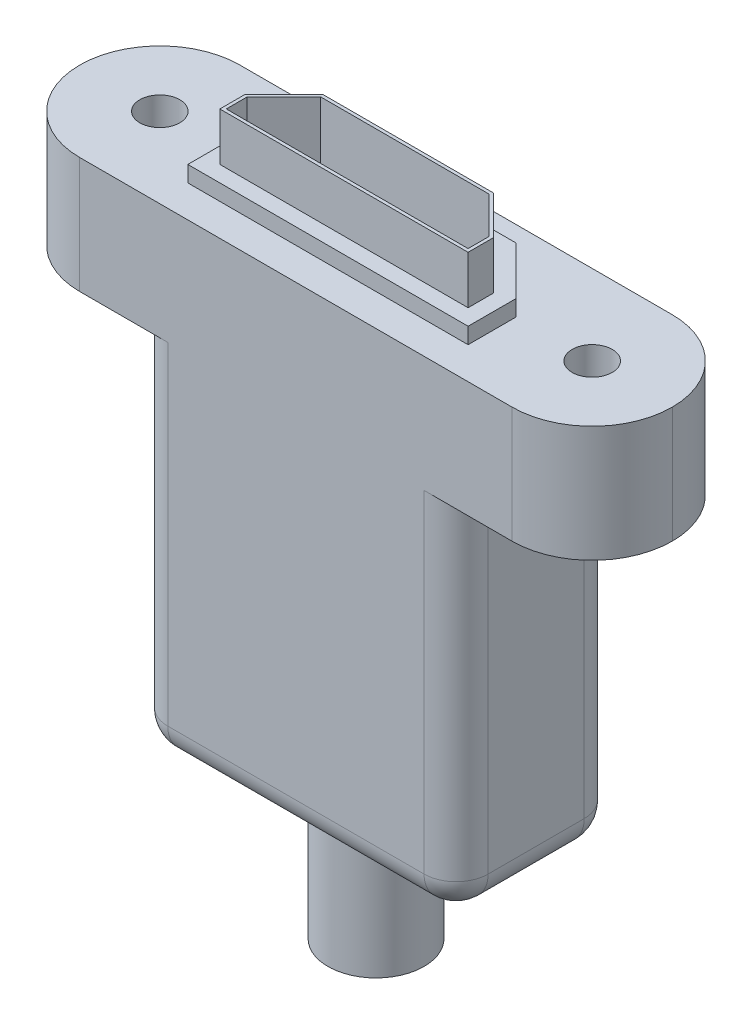
from build123d import *

# Parameters (mm, degrees)
SKETCH_1_W          = 37
SKETCH_1_H          = 10
EXTRUDE_1_DEPTH     = 7.25
EXTRUDE_2_DEPTH     = 4
FILLET_1_R          = 5
CUT_EXTRUDE_1_DEPTH = 3
CUT_EXTRUDE_3_DEPTH = 4
HOLE_WIZARD_M3_1_D  = 2.5
SKETCH_7_W          = 20.003423604
SKETCH_7_H          = 10
EXTRUDE_3_DEPTH     = 22.75
SKETCH_8_R          = 3
EXTRUDE_4_DEPTH     = 8
FILLET_2_R          = 2


with BuildPart() as part:
    # 草图1 → 凸台-拉伸1 (new body)
    with BuildSketch(Plane(origin=(0, 0, 0), x_dir=(1, 0, 0), z_dir=(0, 1, 0))):
        Rectangle(SKETCH_1_W, SKETCH_1_H)
    extrude(amount=EXTRUDE_1_DEPTH)

    # 草图2 → 凸台-拉伸2 (add)
    with BuildSketch(Plane(origin=(0, 7.25, 0), x_dir=(1, 0, 0), z_dir=(0, 1, 0))):
        Polygon((-8.75, 0), (-5.75, 3), (5.75, 3), (8.75, 0), (8.75, -3), (-8.75, -3), align=None)
    extrude(amount=EXTRUDE_2_DEPTH)

    # 圆角1
    fillet_1_edges = [part.edges().sort_by_distance(p)[0] for p in [
        (18.5, 3.625, 5),
        (18.5, 3.625, -5),
        (-18.5, 3.625, 5),
        (-18.5, 3.625, -5),
    ]]
    fillet(fillet_1_edges, radius=FILLET_1_R - 0.0001)  # a hair under: the kernel refuses the full size

    # 草图3 → 切除-拉伸1 (cut)
    with BuildSketch(Plane(origin=(0, 11.25, 0), x_dir=(1, 0, 0), z_dir=(0, 1, 0))):
        Polygon((8.75, -3), (8.75, 0), (5.75, 3), (-5.75, 3), (-8.75, 0), (-8.75, -3), align=None)
        Polygon((7.75, -2), (7.75, -0.414213562), (5.335786438, 2), (-5.335786438, 2), (-7.75, -0.414213562), (-7.75, -2), align=None, mode=Mode.SUBTRACT)
    extrude(amount=-CUT_EXTRUDE_1_DEPTH, mode=Mode.SUBTRACT)

    # 草图4 → 切除-拉伸3 (cut)
    with BuildSketch(Plane(origin=(0, 11.25, 0), x_dir=(1, 0, 0), z_dir=(0, 1, 0))):
        Polygon((-7.55, -0.497056275), (-7.55, -1.8), (7.55, -1.8), (7.55, -0.497056275), (5.252943725, 1.8), (-5.252943725, 1.8), align=None)
    extrude(amount=-CUT_EXTRUDE_3_DEPTH, mode=Mode.SUBTRACT)

    # M3 螺纹孔1 (through all)
    with Locations(Plane(origin=(0, 7.25, 0), x_dir=(1, 0, 0), z_dir=(0, 1, 0))):
        with Locations((-13.5, 0), (13.5, 0)):
            Hole(HOLE_WIZARD_M3_1_D / 2)

    # 草图7 → 凸台-拉伸3 (add)
    with BuildSketch(Plane.XZ):
        Rectangle(SKETCH_7_W, SKETCH_7_H)
    extrude(amount=EXTRUDE_3_DEPTH)

    # 草图8 → 凸台-拉伸4 (add)
    with BuildSketch(Plane.XZ.offset(22.75)):
        with Locations(Location((0, 0, 0), (0, 0, 270))):
            Circle(SKETCH_8_R)
    extrude(amount=EXTRUDE_4_DEPTH)

    # 圆角2
    fillet_2_edges = [part.edges().sort_by_distance(p)[0] for p in [
        (-10.001711802, -11.375, 5),
        (-10.001711802, -11.375, -5),
        (10.001711802, -11.375, -5),
        (10.001711802, -11.375, 5),
        (-10.001711802, -22.75, 0),
        (0, -22.75, -5),
        (10.001711802, -22.75, 0),
        (0, -22.75, 5),
    ]]
    fillet(fillet_2_edges, radius=FILLET_2_R - 0.0001)  # a hair under: the kernel refuses the full size


solid = part.part
